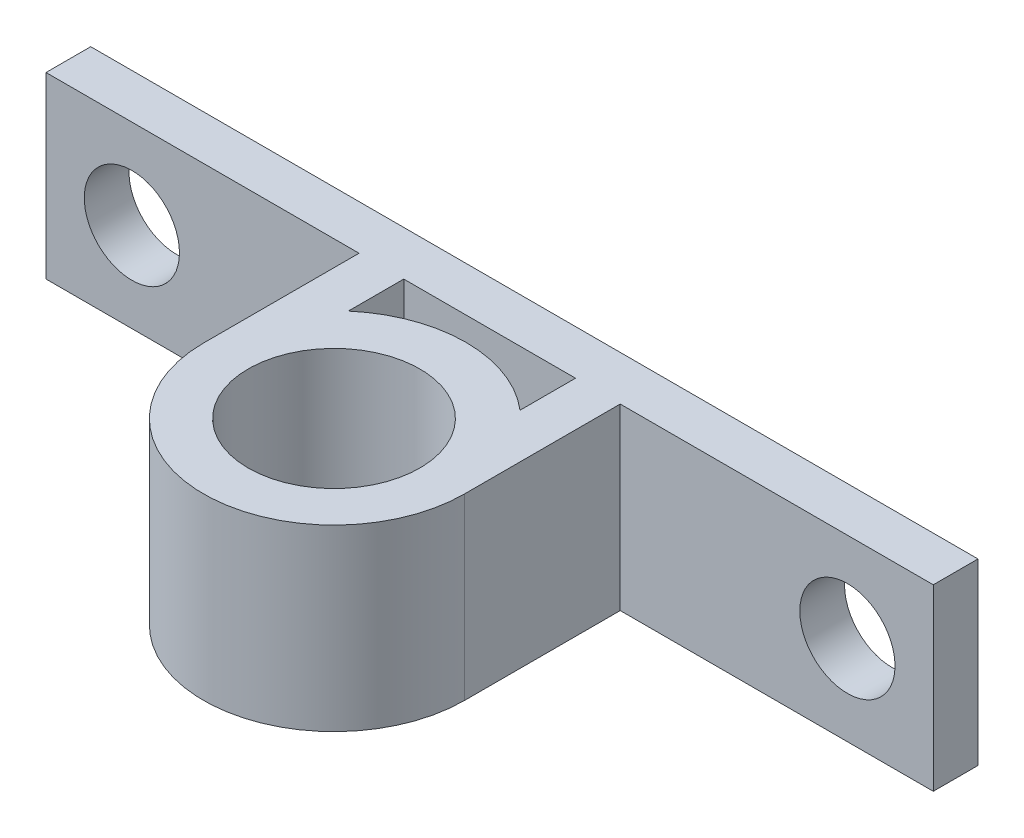
from build123d import *

# Parameters (mm, degrees)
SKETCH1_R           = 6.096
BOSS_EXTRUDE1_DEPTH = 12.7
SKETCH2_R           = 3.3782
CUT_EXTRUDE1_DEPTH  = 40.575123702


with BuildPart() as part:
    # Sketch1 → Boss-Extrude1 (new body)
    with BuildSketch(Plane(origin=(0, 0, 0), x_dir=(1, 0, 0), z_dir=(0, 1, 0))):
        with BuildLine():
            Line((-9.271, 0), (-9.271, 11.049))
            Line((-9.271, 11.049), (-31.496, 11.049))
            Line((-31.496, 11.049), (-31.496, 14.224))
            Line((-31.496, 14.224), (-6.096, 14.224))
            Line((-6.096, 14.224), (6.096, 14.224))
            Line((6.096, 14.224), (31.496, 14.224))
            Line((31.496, 14.224), (31.496, 11.049))
            Line((31.496, 11.049), (9.271, 11.049))
            Line((9.271, 11.049), (9.271, 0))
            ThreePointArc((9.271, 0), (0, -9.271), (-9.271, 0))
        make_face()
        Circle(SKETCH1_R, mode=Mode.SUBTRACT)
        with BuildLine():
            Line((-6.096, 7.112), (-6.096, 11.049))
            Line((-6.096, 11.049), (6.096, 11.049))
            Line((6.096, 11.049), (6.096, 7.112))
            ThreePointArc((6.096, 7.112), (0, 9.367057169), (-6.096, 7.112))
        make_face(mode=Mode.SUBTRACT)
    extrude(amount=BOSS_EXTRUDE1_DEPTH)

    # Sketch2 → Cut-Extrude1 (cut, through all)
    with BuildSketch(Plane.XY.offset(-11.049)):
        with Locations((-25.4, 6.35)):
            Circle(SKETCH2_R)
        with Locations((25.4, 6.35)):
            Circle(SKETCH2_R)
    extrude(amount=-CUT_EXTRUDE1_DEPTH, mode=Mode.SUBTRACT)


solid = part.part
